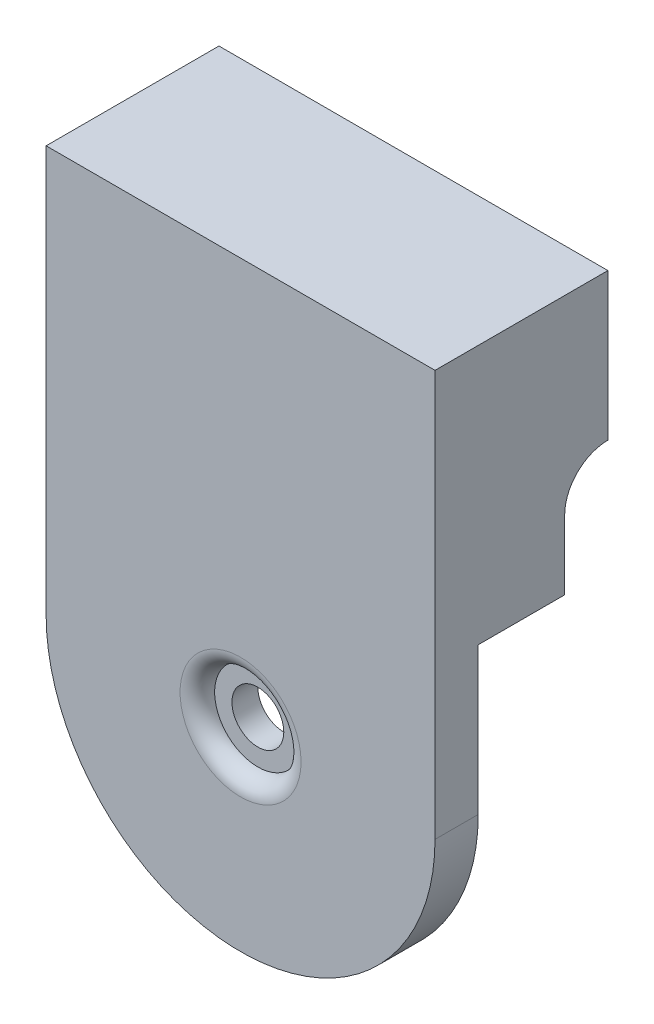
from build123d import *

# Parameters (mm, degrees)
ESBO_O2_R                = 3
RESSALTO_EXTRUS_O1_DEPTH = 5
ESBO_O7_R                = 5
CORTE_EXTRUS_O2_DEPTH    = 2
ESBO_O3_W                = 45
ESBO_O3_H                = 13
RESSALTO_EXTRUS_O2_DEPTH = 10
ESBO_O4_W                = 45
ESBO_O4_H                = 20
RESSALTO_EXTRUS_O3_DEPTH = 17
ESBO_O6_W                = 30.5
ESBO_O6_H                = 6.5
CORTE_EXTRUS_O1_DEPTH    = 15
FILETE4_R                = 5
FILETE5_R                = 2


with BuildPart() as part:
    # Esboço2 → Ressalto-extrusão1 (new body)
    with BuildSketch(Plane.XY):
        with BuildLine():
            Line((-22.5, 0), (-22.5, 30))
            Line((-22.5, 30), (22.5, 30))
            Line((22.5, 30), (22.5, 0))
            ThreePointArc((22.5, 0), (0, -22.5), (-22.5, 0))
        make_face()
        Circle(ESBO_O2_R, mode=Mode.SUBTRACT)
    extrude(amount=RESSALTO_EXTRUS_O1_DEPTH)

    # Esboço7 → Corte-extrusão2 (cut)
    with BuildSketch(Plane.XY.offset(5)):
        Circle(ESBO_O7_R)
    extrude(amount=-CORTE_EXTRUS_O2_DEPTH, mode=Mode.SUBTRACT)

    # Esboço3 → Ressalto-extrusão2 (add)
    with BuildSketch(Plane(origin=(0, 0, 0), x_dir=(-1, 0, 0), z_dir=(0, 0, -1))):
        with Locations((0, 23.5)):
            Rectangle(ESBO_O3_W, ESBO_O3_H)
    extrude(amount=RESSALTO_EXTRUS_O2_DEPTH)

    # Esboço4 → Ressalto-extrusão3 (add)
    with BuildSketch(Plane(origin=(0, 30, 0), x_dir=(1, 0, 0), z_dir=(0, 1, 0))):
        with Locations((0, 5)):
            Rectangle(ESBO_O4_W, ESBO_O4_H)
    extrude(amount=RESSALTO_EXTRUS_O3_DEPTH)

    # Esboço6 → Corte-extrusão1 (cut)
    with BuildSketch(Plane(origin=(0, 0, -15), x_dir=(-1, 0, 0), z_dir=(0, 0, -1))):
        with Locations((0, 38.5)):
            Rectangle(ESBO_O6_W, ESBO_O6_H)
    extrude(amount=-CORTE_EXTRUS_O1_DEPTH, mode=Mode.SUBTRACT)

    # Filete4
    filete4_edges = [part.edges().sort_by_distance(p)[0] for p in [
        (0, 30, -10),
    ]]
    fillet(filete4_edges, radius=FILETE4_R - 0.0001)  # a hair under: the kernel refuses the full size

    # Filete5
    filete5_edges = [part.edges().sort_by_distance(p)[0] for p in [
        (-5, 0, 5),
    ]]
    fillet(filete5_edges, radius=FILETE5_R - 0.0001)  # a hair under: the kernel refuses the full size


solid = part.part
